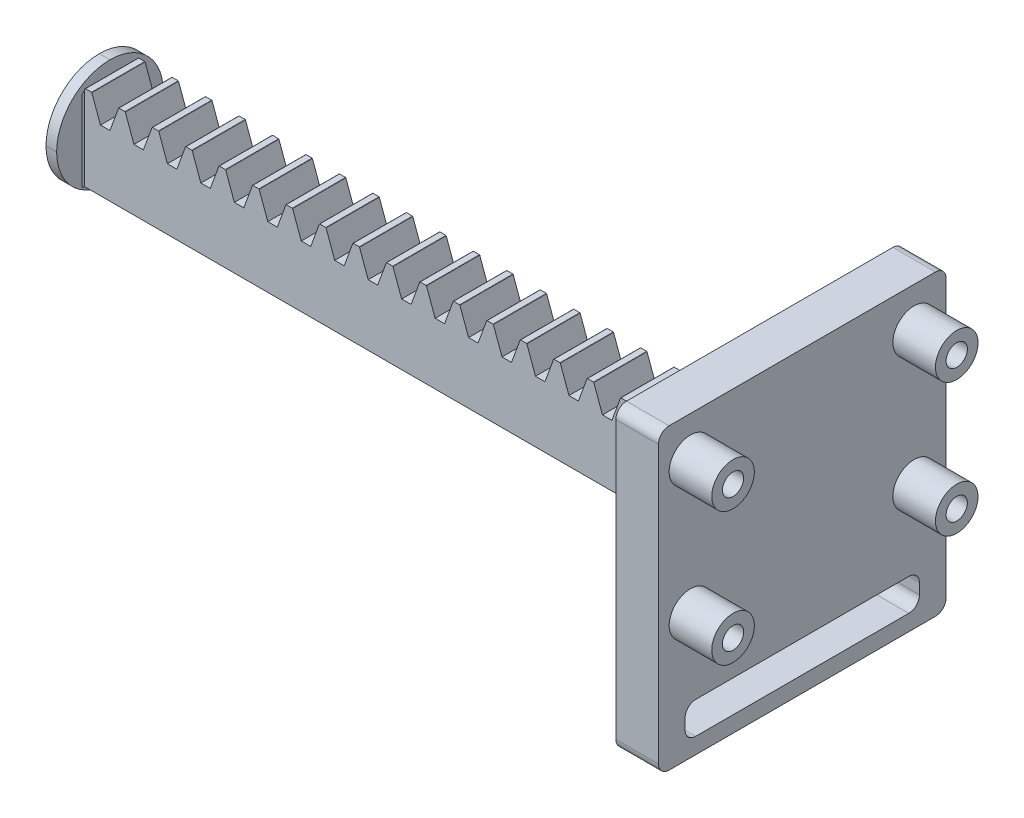
from build123d import *

# Parameters (mm, degrees)
BLANKSKE_W          = 125
BLANKSKE_H          = 6
BLANK_DEPTH         = 5
TOOTHCUTILL_DEPTH   = 126.24376232
TOOTHCUTSIM_DEPTH   = 126.24376232
TEETHCUTS_COUNT     = 41
TEETHCUTS_PITCH     = 3.14159265
SKETCH1_W           = 125
SKETCH1_H           = 2
BOSS_EXTRUDE1_DEPTH = 5
SKETCH2_W           = 32.5
SKETCH2_H           = 10.934731935
SKETCH2_H_2         = 12.379467754
CUT_EXTRUDE1_DEPTH  = 42
SKETCH3_W           = 10
SKETCH3_H           = 10
BOSS_EXTRUDE2_DEPTH = 1
SKETCH4_W           = 10
SKETCH4_H           = 10
BOSS_EXTRUDE3_DEPTH = 1
CHAMFER1_SIZE       = 0.1
FILLET1_R           = 5
SKETCH8_W           = 27
SKETCH8_H           = 28
BOSS_EXTRUDE5_DEPTH = 4
SKETCH9_R           = 1
CUT_EXTRUDE4_DEPTH  = 11
FILLET2_R           = 1
SKETCH10_W          = 22
SKETCH10_H          = 3
CUT_EXTRUDE5_DEPTH  = 10
FILLET3_R           = 1
SKETCH11_R          = 2
SKETCH11_R_2        = 1
BOSS_EXTRUDE6_DEPTH = 4


with BuildPart() as part:
    # BlankSke → Blank (new body)
    with BuildSketch(Plane.XY):
        with Locations((62.5, 3)):
            Rectangle(BLANKSKE_W, BLANKSKE_H)
    extrude(amount=-BLANK_DEPTH)

    # TooCutSkeIll → ToothCutIll (cut, through all)
    with BuildSketch(Plane.XY):
        with BuildLine():
            Line((-1.253788993, 5.973680806), (-0.504546125, 3.915152944))
            ThreePointArc((-0.504546125, 3.915152944), (-0.412650963, 3.795392837), (-0.268683278, 3.75))
            Line((-0.268683278, 3.75), (0.268683278, 3.75))
            ThreePointArc((0.268683278, 3.75), (0.412650963, 3.795392837), (0.504546125, 3.915152944))
            Line((0.504546125, 3.915152944), (1.253788993, 5.973680806))
            ThreePointArc((1.253788993, 5.973680806), (1.268433641, 5.992766082), (1.291376698, 6))
            Line((1.291376698, 6), (1.291376698, 6.0254))
            Line((1.291376698, 6.0254), (-1.291376698, 6.0254))
            Line((-1.291376698, 6.0254), (-1.291376698, 6))
            ThreePointArc((-1.291376698, 6), (-1.268433641, 5.992766082), (-1.253788993, 5.973680806))
        make_face()
    toothcutill = extrude(amount=-TOOTHCUTILL_DEPTH, mode=Mode.SUBTRACT)

    # TooCutSkeSim → ToothCutSim (cut, through all)
    with BuildSketch(Plane.XY):
        Polygon((0.44443537, 3.75), (-0.44443537, 3.75), (-1.272613241, 6.0254), (1.272613241, 6.0254), align=None)
    toothcutsim = extrude(amount=-TOOTHCUTSIM_DEPTH, mode=Mode.SUBTRACT)

    # TeethCuts: ToothCutIll, ToothCutSim ×41
    with Locations(*[(i * TEETHCUTS_PITCH, 0, 0) for i in range(1, TEETHCUTS_COUNT)]):
        add(toothcutill, mode=Mode.SUBTRACT)
        add(toothcutsim, mode=Mode.SUBTRACT)

    # Sketch1 → Boss-Extrude1 (add)
    with BuildSketch(Plane.XY):
        with Locations((62.5, -1)):
            Rectangle(SKETCH1_W, SKETCH1_H)
    extrude(amount=-BOSS_EXTRUDE1_DEPTH)

    # Sketch2 → Cut-Extrude1 (cut)
    with BuildSketch(Plane(origin=(0, 0, -5), x_dir=(-1, 0, 0), z_dir=(0, 0, -1))):
        with Locations((-108.75, 3.467365968)):
            Rectangle(SKETCH2_W, SKETCH2_H)
        with Locations((-16.25, 4.189733877)):
            Rectangle(SKETCH2_W, SKETCH2_H_2)
    extrude(amount=-CUT_EXTRUDE1_DEPTH, mode=Mode.SUBTRACT)

    # Sketch3 → Boss-Extrude2 (add)
    with BuildSketch(Plane.ZY.offset(-32.5)):
        with Locations((-2.5, 2)):
            Rectangle(SKETCH3_W, SKETCH3_H)
    extrude(amount=BOSS_EXTRUDE2_DEPTH)

    # Sketch4 → Boss-Extrude3 (add)
    with BuildSketch(Plane(origin=(92.5, 0, 0), x_dir=(0, 0, -1), z_dir=(1, 0, 0))):
        with Locations((2.5, 2)):
            Rectangle(SKETCH4_W, SKETCH4_H)
    extrude(amount=BOSS_EXTRUDE3_DEPTH)

    # Chamfer1
    chamfer1_edges = [part.edges().sort_by_distance(p)[0] for p in [
        (32.5, -2, -2.5),
        (92.5, -2, -2.5),
        (92.5, 2, 0),
        (92.5, 2, -5),
        (32.5, 1.75369566, 0),
        (32.5, 1.75369566, -5),
    ]]
    chamfer(chamfer1_edges, length=CHAMFER1_SIZE)

    # Fillet1
    fillet1_edges = [part.edges().sort_by_distance(p)[0] for p in [
        (32, -3, 2.5),
        (32, -3, -7.5),
        (32, 7, -7.5),
        (32, 7, 2.5),
        (93, 7, 2.5),
        (93, 7, -7.5),
        (93, -3, 2.5),
        (93, -3, -7.5),
    ]]
    fillet(fillet1_edges, radius=FILLET1_R - 0.0001)  # a hair under: the kernel refuses the full size

    # Sketch8 → Boss-Extrude5 (add)
    with BuildSketch(Plane(origin=(93.5, 0, 0), x_dir=(0, 0, -1), z_dir=(1, 0, 0))):
        with Locations((2.5, 2)):
            Rectangle(SKETCH8_W, SKETCH8_H)
    extrude(amount=BOSS_EXTRUDE5_DEPTH)

    # Sketch9 → Cut-Extrude4 (cut)
    with BuildSketch(Plane.ZY.offset(-93.5)):
        with Locations((-13, 12.25)):
            Circle(SKETCH9_R)
        with Locations((8, 12.25)):
            Circle(SKETCH9_R)
        with Locations((8, -0.25)):
            Circle(SKETCH9_R)
        with Locations((-13, -0.25)):
            Circle(SKETCH9_R)
    extrude(amount=-CUT_EXTRUDE4_DEPTH, mode=Mode.SUBTRACT)

    # Fillet2
    fillet2_edges = [part.edges().sort_by_distance(p)[0] for p in [
        (95.5, -12, -16),
        (95.5, 16, -16),
        (95.5, 16, 11),
        (95.5, -12, 11),
    ]]
    fillet(fillet2_edges, radius=FILLET2_R)

    # Sketch10 → Cut-Extrude5 (cut)
    with BuildSketch(Plane(origin=(97.5, 0, 0), x_dir=(0, 0, -1), z_dir=(1, 0, 0))):
        with Locations((2.5, -9)):
            Rectangle(SKETCH10_W, SKETCH10_H)
    extrude(amount=-CUT_EXTRUDE5_DEPTH, mode=Mode.SUBTRACT)

    # Fillet3
    fillet3_edges = [part.edges().sort_by_distance(p)[0] for p in [
        (95.5, -7.5, -13.5),
        (95.5, -10.5, -13.5),
        (95.5, -10.5, 8.5),
        (95.5, -7.5, 8.5),
    ]]
    fillet(fillet3_edges, radius=FILLET3_R)

    # Sketch11 → Boss-Extrude6 (add)
    # profile 1 of 4: a face of its own
    with BuildSketch(Plane(origin=(97.5, 0, 0), x_dir=(0, 0, -1), z_dir=(1, 0, 0))):
        with Locations(Location((-8, 12.25, 0), (0, 0, 180))):
            Circle(SKETCH11_R)
        with Locations(Location((-8, 12.25, 0), (0, 0, 180))):
            Circle(SKETCH11_R_2, mode=Mode.SUBTRACT)
    # profile 2 of 4: a face of its own
    with BuildSketch(Plane(origin=(97.5, 0, 0), x_dir=(0, 0, -1), z_dir=(1, 0, 0))):
        with Locations(Location((-8, -0.25, 0), (0, 0, 180))):
            Circle(SKETCH11_R)
        with Locations(Location((-8, -0.25, 0), (0, 0, 180))):
            Circle(SKETCH11_R_2, mode=Mode.SUBTRACT)
    # profile 3 of 4: a face of its own
    with BuildSketch(Plane(origin=(97.5, 0, 0), x_dir=(0, 0, -1), z_dir=(1, 0, 0))):
        with Locations(Location((13, -0.25, 0), (0, 0, 180))):
            Circle(SKETCH11_R)
        with Locations(Location((13, -0.25, 0), (0, 0, 180))):
            Circle(SKETCH11_R_2, mode=Mode.SUBTRACT)
    # profile 4 of 4: a face of its own
    with BuildSketch(Plane(origin=(97.5, 0, 0), x_dir=(0, 0, -1), z_dir=(1, 0, 0))):
        with Locations(Location((13, 12.25, 0), (0, 0, 180))):
            Circle(SKETCH11_R)
        with Locations(Location((13, 12.25, 0), (0, 0, 180))):
            Circle(SKETCH11_R_2, mode=Mode.SUBTRACT)
    extrude(amount=BOSS_EXTRUDE6_DEPTH)


solid = part.part
